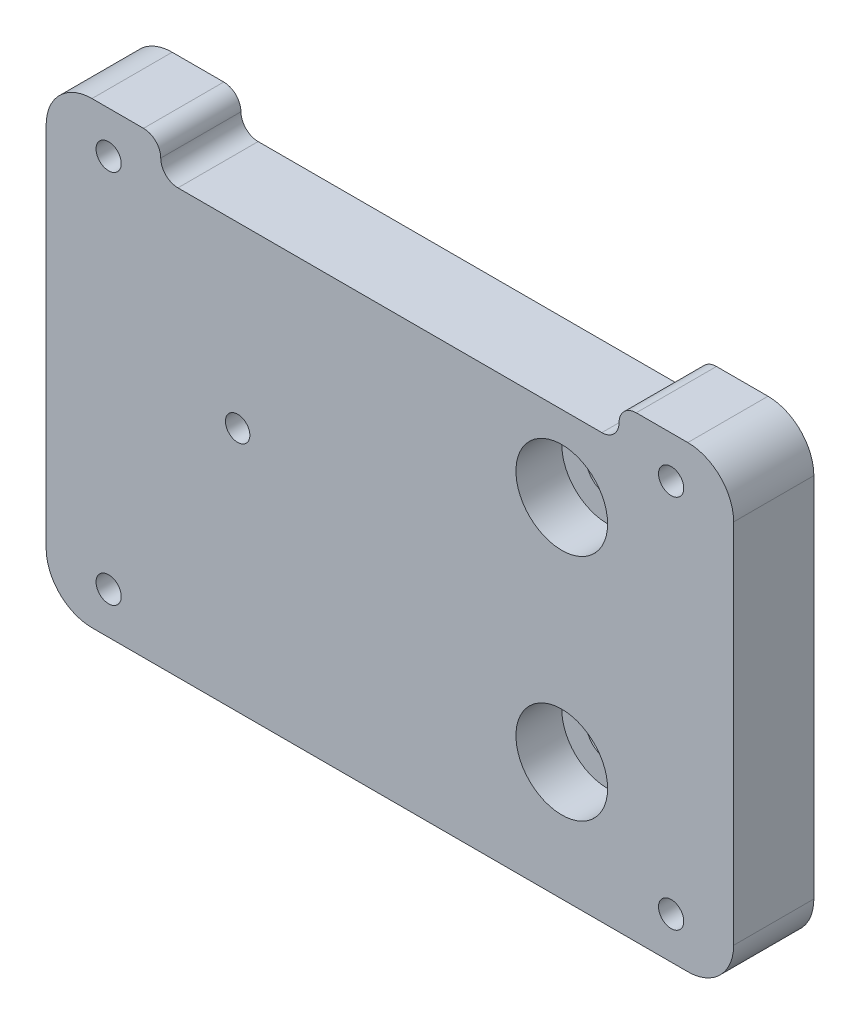
from build123d import *

# Parameters (mm, degrees)
SKETCH1_W             = 76.2
SKETCH1_H             = 50.8
SKETCH1_R             = 1.397
BOSS_EXTRUDE1_DEPTH   = 8.89
FILLET1_R             = 5.08
SKETCH2_R             = 2.370137615
CUT_EXTRUDE1_DEPTH    = 47.645493887
SKETCH3_R             = 5.08
CUT_EXTRUDE2_DEPTH    = 5.08
SKETCH4_W             = 50.8
SKETCH4_H             = 3.81
CUT_EXTRUDE3_DEPTH    = 47.645493887
FILLET2_R             = 1.905
F_6_32_TAPPED_HOLE1_D = 2.7051


with BuildPart() as part:
    # Sketch1 → Boss-Extrude1 (new body)
    with BuildSketch(Plane.XY):
        Rectangle(SKETCH1_W, SKETCH1_H)
        with Locations((-31.172764277, -20.781842852)):
            Circle(SKETCH1_R, mode=Mode.SUBTRACT)
        with Locations((31.172764277, 20.781842852)):
            Circle(SKETCH1_R, mode=Mode.SUBTRACT)
        with Locations((-31.172764277, 20.781842852)):
            Circle(SKETCH1_R, mode=Mode.SUBTRACT)
        with Locations((31.172764277, -20.781842852)):
            Circle(SKETCH1_R, mode=Mode.SUBTRACT)
    extrude(amount=BOSS_EXTRUDE1_DEPTH)

    # Fillet1
    fillet1_edges = [part.edges().sort_by_distance(p)[0] for p in [
        (38.1, -25.4, 4.445),
        (-38.1, -25.4, 4.445),
        (-38.1, 25.4, 4.445),
        (38.1, 25.4, 4.445),
    ]]
    fillet(fillet1_edges, radius=FILLET1_R)

    # Sketch2 → Cut-Extrude1 (cut, through all)
    with BuildSketch(Plane.XY.offset(8.89)):
        with Locations((19.05, 13.146852544)):
            Circle(SKETCH2_R)
        with Locations((19.05, -12.253147456)):
            Circle(SKETCH2_R)
    extrude(amount=-CUT_EXTRUDE1_DEPTH, mode=Mode.SUBTRACT)

    # Sketch3 → Cut-Extrude2 (cut)
    with BuildSketch(Plane.XY.offset(8.89)):
        with Locations((19.05, 13.146852544)):
            Circle(SKETCH3_R)
        with Locations((19.05, -12.253147456)):
            Circle(SKETCH3_R)
    extrude(amount=-CUT_EXTRUDE2_DEPTH, mode=Mode.SUBTRACT)

    # Sketch4 → Cut-Extrude3 (cut, through all)
    with BuildSketch(Plane.XY.offset(8.89)):
        with Locations((0, 23.495)):
            Rectangle(SKETCH4_W, SKETCH4_H)
    extrude(amount=-CUT_EXTRUDE3_DEPTH, mode=Mode.SUBTRACT)

    # Fillet2
    fillet2_edges = [part.edges().sort_by_distance(p)[0] for p in [
        (25.4, 21.59, 4.445),
        (-25.4, 21.59, 4.445),
    ]]
    fillet(fillet2_edges, radius=FILLET2_R)
    fillet2_2_edges = [part.edges().sort_by_distance(p)[0] for p in [
        (25.4, 25.4, 4.445),
        (-25.4, 25.4, 4.445),
    ]]
    fillet(fillet2_2_edges, radius=FILLET2_R - 0.0001)  # a hair under: the kernel refuses the full size

    # #6-32 Tapped Hole1 (through all)
    with Locations(Plane.XY.offset(8.89)):
        with Locations((-16.875568399, 1.822244587)):
            Hole(F_6_32_TAPPED_HOLE1_D / 2)


solid = part.part
